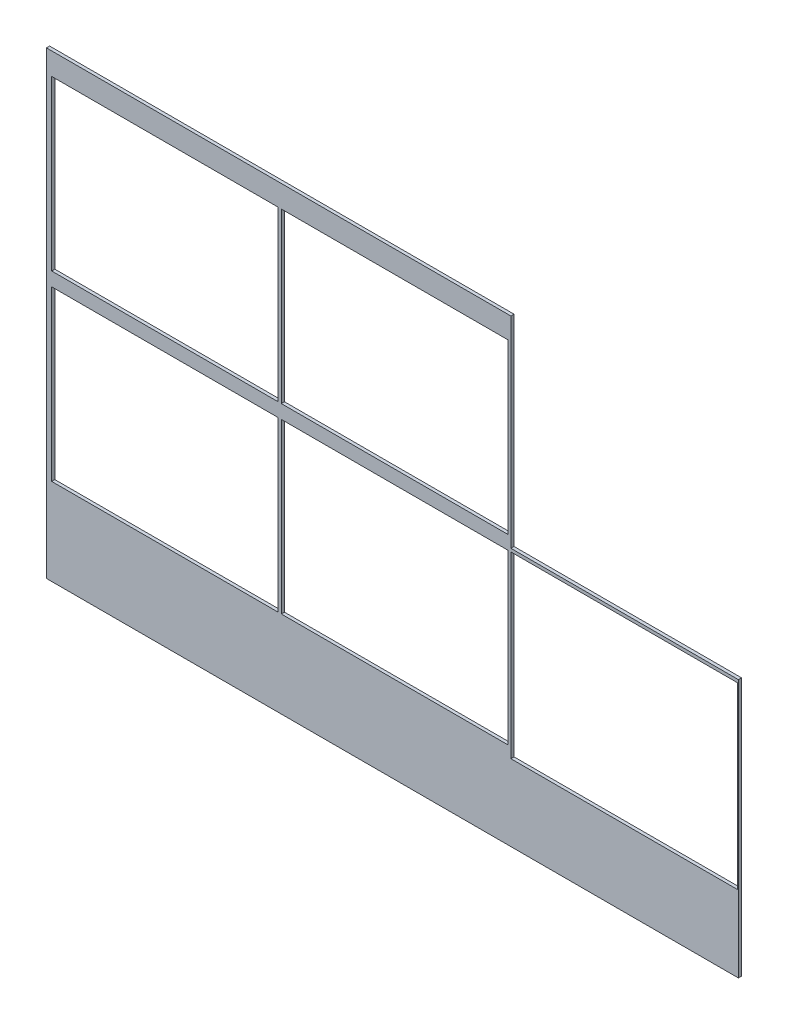
from build123d import *

# Parameters (mm, degrees)
EXTRUDE_1_DEPTH             = 6
SKETCH_2_W                  = 430
SKETCH_2_H                  = 320
CUT_EXTRUDE_1_DEPTH         = 985.927758772
PATTERN_LINEAR_1_COUNT      = 2
PATTERN_LINEAR_1_PITCH      = 436
PATTERN_LINEAR_1_COUNT_DIR2 = 2
PATTERN_LINEAR_1_PITCH_DIR2 = 346
SKETCH_3_W                  = 430
SKETCH_3_H                  = 340
CUT_EXTRUDE_2_DEPTH         = 985.927758772


with BuildPart() as part:
    # Эскиз1 → Бобышка-Вытянуть1 (new body)
    with BuildSketch(Plane.XY):
        Polygon((-431, -436.3), (-431, 436.3), (451, 436.3), (451, 54.3), (883, 54.3), (883, -436.3), align=None)
    extrude(amount=-EXTRUDE_1_DEPTH)

    # Эскиз2 → Вырез-Вытянуть1 (cut, through all)
    with BuildSketch(Plane(origin=(0, 0, -6), x_dir=(-1, 0, 0), z_dir=(0, 0, -1))):
        with Locations((-230, 234.3)):
            Rectangle(SKETCH_2_W, SKETCH_2_H)
    cut_extrude_1 = extrude(amount=-CUT_EXTRUDE_1_DEPTH, mode=Mode.SUBTRACT)

    # Линейный массив1: Cut-Extrude 1 2 × 2
    with Locations(*[(-i * PATTERN_LINEAR_1_PITCH, -j * PATTERN_LINEAR_1_PITCH_DIR2, 0) for i in range(PATTERN_LINEAR_1_COUNT) for j in range(PATTERN_LINEAR_1_COUNT_DIR2) if (i, j) != (0, 0)]):
        add(cut_extrude_1, mode=Mode.SUBTRACT)

    # Эскиз3 → Вырез-Вытянуть2 (cut, through all)
    with BuildSketch(Plane.XY):
        with Locations((666, -121.7)):
            Rectangle(SKETCH_3_W, SKETCH_3_H)
    extrude(amount=-CUT_EXTRUDE_2_DEPTH, mode=Mode.SUBTRACT)


solid = part.part
